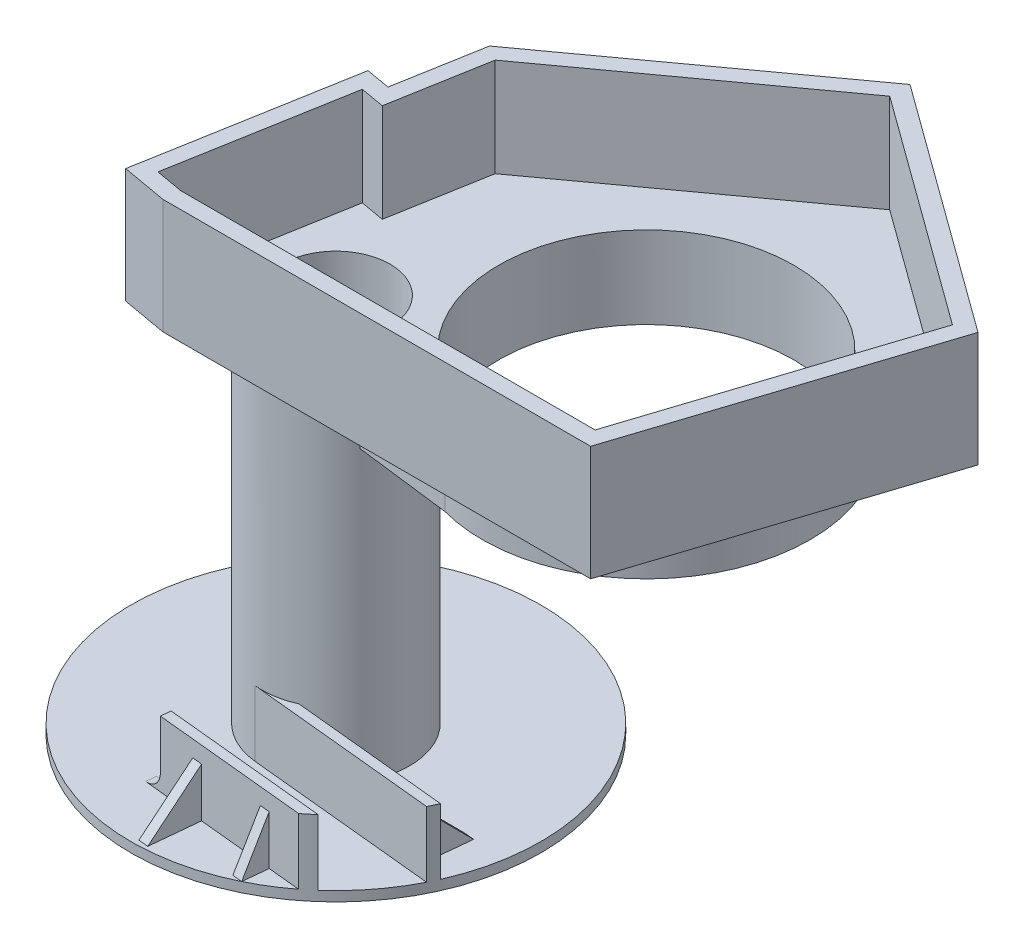
from build123d import *
from build123d.topology import SkipClean

# Parameters (mm, degrees)
SKETCH1_R               = 45
BOSS_EXTRUDE1_DEPTH     = 35
CUT_EXTRUDE1_DEPTH      = 30
BOSS_EXTRUDE2_START     = 20
SKETCH3_R               = 50
SKETCH3_R_2             = 45
BOSS_EXTRUDE2_DEPTH     = 20
SKETCH4_R               = 22.5
BOSS_EXTRUDE3_DEPTH     = 108
SKETCH5_R               = 62.5
BOSS_EXTRUDE4_DEPTH     = 3
CUT_EXTRUDE2_DEPTH      = 283.934340716
CUT_EXTRUDE2_DEPTH_BACK = 283.934340716
SKETCH6_R               = 16.5
CHAMFER1_START          = -20
CHAMFER1_DEPTH          = 20
BOSS_EXTRUDE5_START     = 20
BOSS_EXTRUDE5_DEPTH     = 20
CHAMFER3_START          = -59.701385296
CHAMFER3_DEPTH          = 31.623598411
CHAMFER3_START_2        = -32.908910756
CHAMFER3_2_DEPTH        = 24.320342802
CHAMFER3_START_3        = -75.100600507
CHAMFER3_3_DEPTH        = 17.710815412
CHAMFER3_START_4        = -108
CHAMFER3_4_DEPTH        = 20.0000001
CUT_EXTRUDE3_START      = 20
CUT_EXTRUDE3_DEPTH      = 20
CUT_EXTRUDE4_DEPTH      = 3
FILLET2_R               = 5


with BuildPart() as part:
    # Sketch1 → Boss-Extrude1 (new body)
    with BuildSketch(Plane(origin=(0, 0, 0), x_dir=(1, 0, 0), z_dir=(0, 1, 0))):
        Polygon((46.859255168, 63.80155033), (-83.545615043, 63.80155033), (-97.357476794, 66.23695421), (-86.281022646, 129.054647247), (-78.894964498, 127.752285914), (-74.254340533, 154.070572239), (0, 208.019508525), (75.819867549, 152.933150283), align=None)
        with Locations(Location((0, 127.60310066, 0), (0, 0, 90))):
            Circle(SKETCH1_R, mode=Mode.SUBTRACT)
    extrude(amount=BOSS_EXTRUDE1_DEPTH)

    # Sketch2 → Cut-Extrude1 (cut)
    with BuildSketch(Plane(origin=(0, 35, 0), x_dir=(1, 0, 0), z_dir=(0, 1, 0))):
        Polygon((69.942015026, 151.023320226), (0, 201.839168637), (-69.681093857, 151.212890552), (-74.839166621, 121.960006261), (-82.225224769, 123.262367593), (-91.56519714, 70.292752087), (-83.108171726, 68.80155033), (43.226542528, 68.80155033), align=None)
    extrude(amount=-CUT_EXTRUDE1_DEPTH, mode=Mode.SUBTRACT)

    # Sketch3 → Boss-Extrude2 (add)
    with BuildSketch(Plane.XZ.offset(BOSS_EXTRUDE2_START)):
        with Locations(Location((0, -127.60310066, 0), (0, 0, 270))):
            Circle(SKETCH3_R)
        with Locations(Location((0, -127.60310066, 0), (0, 0, 270))):
            Circle(SKETCH3_R_2, mode=Mode.SUBTRACT)
    extrude(amount=-BOSS_EXTRUDE2_DEPTH)

    # Sketch4 → Boss-Extrude3 (add)
    with BuildSketch(Plane.XZ):
        with Locations(Location((-61.853227661, -94.828442341, 0), (0, 0, 354.769849307))):
            Circle(SKETCH4_R)
    extrude(amount=BOSS_EXTRUDE3_DEPTH)

    # Sketch5 → Boss-Extrude4 (add)
    with BuildSketch(Plane.XZ.offset(108)):
        with Locations(Location((-61.853227661, -94.828442341, 0), (0, 0, 270))):
            Circle(SKETCH5_R)
    extrude(amount=BOSS_EXTRUDE4_DEPTH)

    # Sketch6 → Cut-Extrude2 (cut, two sides: drawn at the far end of the back side and taken through both)
    with BuildSketch(Plane.XZ.offset(111).offset(-CUT_EXTRUDE2_DEPTH_BACK)):
        with Locations(Location((-61.853227661, -94.828442341, 0), (0, 0, 270))):
            Circle(SKETCH6_R)
    extrude(amount=CUT_EXTRUDE2_DEPTH + CUT_EXTRUDE2_DEPTH_BACK, mode=Mode.SUBTRACT)

    # Chamfer1: read off the stored shape, not the designer's step
    # Chamfer1 outline → Chamfer1 (add)
    with BuildSketch(Plane(origin=(0, 0, 0), x_dir=(1, 0, 0), z_dir=(0, 1, 0)).offset(CHAMFER1_START)):
        with BuildLine():
            ThreePointArc((-47.573643712, 112.216469321), (-49.998001272, 128.050167568), (-47.290893773, 143.837981816))
            Line((-47.290893773, 143.837981816), (-60.85462884, 117.306271426))
            ThreePointArc((-60.85462884, 117.306271426), (-53.801380758, 115.838386688), (-47.573643712, 112.216469321))
        make_face()
        with BuildLine():
            Line((-42.693487755, 83.032071427), (-13.123343442, 79.356050419))
            ThreePointArc((-13.123343442, 79.356050419), (-27.706953652, 85.981895496), (-39.446904898, 96.879466533))
            ThreePointArc((-39.446904898, 96.879466533), (-39.947247216, 89.692488608), (-42.693487755, 83.032071427))
        make_face()
    extrude(amount=CHAMFER1_DEPTH)

    # Sketch7 → Boss-Extrude5 (add)
    with SkipClean():  # the faces are left unmerged after this step: merging them gives an invalid solid
        with BuildSketch(Plane(origin=(0, -108, 0), x_dir=(1, 0, 0), z_dir=(0, 1, 0)).offset(BOSS_EXTRUDE5_START)):
            with BuildLine():
                Line((-70.209230864, 52.9494319), (-20.454240978, 48.005649797))
                ThreePointArc((-20.454240978, 48.005649797), (-22.061100088, 46.632627344), (-23.713465467, 45.314721618))
                Line((-23.713465467, 45.314721618), (-70.50585779, 49.964132507))
                Line((-70.50585779, 49.964132507), (-70.209230864, 52.9494319))
            make_face()
            with BuildLine():
                Line((-64.077929608, 72.438696893), (-6.054139097, 66.673305768))
                ThreePointArc((-6.054139097, 66.673305768), (-5.354795719, 68.104348565), (-4.69214598, 69.552747672))
                Line((-4.69214598, 69.552747672), (-52.611335155, 74.314119956))
                ThreePointArc((-52.611335155, 74.314119956), (-58.221486515, 72.623477665), (-64.077929608, 72.438696893))
            make_face()
        extrude(amount=-BOSS_EXTRUDE5_DEPTH)

    # Chamfer3: read off the stored shape, not the designer's step
    # Chamfer3 outline → Chamfer3 (add)
    with SkipClean():  # the faces are left unmerged after this step: merging them gives an invalid solid
        with BuildSketch(Plane(origin=(0, 0, 0), x_dir=(0, 1, 0), z_dir=(0.9950997977115372, 0, 0.09887564206849853)).offset(CHAMFER3_START)):
            Polygon((-108, -68.747986192), (-108, -83.747986192), (-93, -68.747986192), align=None)
            Polygon((-108, -27.747986192), (-108, -42.747986192), (-93, -42.747986192), align=None)
        extrude(amount=CHAMFER3_DEPTH)

    # Chamfer3 2 outline → Chamfer3 2 (add)
    with SkipClean():  # the faces are left unmerged after this step: merging them gives an invalid solid
        with BuildSketch(Plane(origin=(0, 0, 0), x_dir=(0, 1, 0), z_dir=(0.9950997977115372, 0, 0.09887564206849853)).offset(CHAMFER3_START_2)):
            Polygon((-108, -68.747986192), (-108, -83.747986192), (-93, -68.747986192), align=None)
        extrude(amount=CHAMFER3_2_DEPTH)

    # Chamfer3 3 outline → Chamfer3 3 (add)
    with SkipClean():  # the faces are left unmerged after this step: merging them gives an invalid solid
        with BuildSketch(Plane(origin=(0, 0, 0), x_dir=(0, 1, 0), z_dir=(0.9950997977115372, 0, 0.09887564206849853)).offset(CHAMFER3_START_3)):
            Polygon((-108, -27.747986192), (-108, -42.747986192), (-93, -42.747986192), align=None)
        extrude(amount=CHAMFER3_3_DEPTH)

    # Chamfer3 4 outline → Chamfer3 4 (cut)
    with SkipClean():  # the faces are left unmerged after this step: merging them gives an invalid solid
        with BuildSketch(Plane(origin=(0, 0, 0), x_dir=(1, 0, 0), z_dir=(0, 1, 0)).offset(CHAMFER3_START_4)):
            with BuildLine():
                Line((-51.128200524, 89.240616922), (-51.879001502, 81.68443943))
                ThreePointArc((-51.879001502, 81.68443943), (-48.702503608, 84.863079484), (-46.501448484, 88.780891094))
                Line((-46.501448484, 88.780891094), (-51.128200524, 89.240616922))
            make_face()
            with BuildLine():
                ThreePointArc((-0.265846327, 84.186804289), (-2.029835327, 76.733920253), (-4.69214598, 69.552747672))
                Line((-4.69214598, 69.552747672), (-1.748980958, 69.260307324))
                Line((-1.748980958, 69.260307324), (-0.265846327, 84.186804289))
            make_face()
            with BuildLine():
                ThreePointArc((-23.713465467, 45.314721618), (-37.1988252, 37.396652892), (-52.227673534, 33.074100731))
                Line((-52.227673534, 33.074100731), (-25.196600099, 30.388224653))
                Line((-25.196600099, 30.388224653), (-23.713465467, 45.314721618))
            make_face()
        extrude(amount=CHAMFER3_4_DEPTH, mode=Mode.SUBTRACT)

    # Sketch9 → Cut-Extrude3 (cut)
    with SkipClean():  # the faces are left unmerged after this step: merging them gives an invalid solid
        with BuildSketch(Plane(origin=(0, -108, 0), x_dir=(1, 0, 0), z_dir=(0, 1, 0)).offset(CUT_EXTRUDE3_START)):
            Polygon((-61.020192816, 33.947747767), (-75.946689782, 35.430882398), (-74.463555151, 50.357379364), (-59.537058185, 48.874244733), align=None)
            Polygon((-56.551758792, 48.577617807), (-58.034893423, 33.651120841), (-38.132897469, 31.673608), (-36.649762838, 46.600104965), align=None)
            Polygon((-33.664463445, 46.303478039), (-35.147598076, 31.376981073), (-15.245602121, 29.399468232), (-13.76246749, 44.325965198), align=None)
            Polygon((-33.104139652, 87.449700478), (-34.587274283, 72.523203512), (-14.685278328, 70.54569067), (-13.202143697, 85.472187636), align=None)
            with BuildLine():
                Line((-36.089439045, 87.746327404), (-37.572573676, 72.819830438))
                Line((-37.572573676, 72.819830438), (-52.611335155, 74.314119956))
                ThreePointArc((-52.611335155, 74.314119956), (-44.996440318, 79.925465442), (-40.360787322, 88.170739412))
                Line((-40.360787322, 88.170739412), (-36.089439045, 87.746327404))
            make_face()
            with BuildLine():
                Line((-0.265846327, 84.186804289), (-10.216844304, 85.17556071))
                Line((-10.216844304, 85.17556071), (-11.699978935, 70.249063744))
                Line((-11.699978935, 70.249063744), (-4.69214598, 69.552747672))
                ThreePointArc((-4.69214598, 69.552747672), (-2.029835327, 76.733920253), (-0.265846327, 84.186804289))
            make_face()
        extrude(amount=-CUT_EXTRUDE3_DEPTH, mode=Mode.SUBTRACT)

    # Sketch10 → Cut-Extrude4 (cut)
    with SkipClean():  # the faces are left unmerged after this step: merging them gives an invalid solid
        with BuildSketch(Plane(origin=(-37.891198026, 0, -3.764965627), x_dir=(-0.09887564206850087, 0, 0.995099797711537), z_dir=(-0.995099797711537, 0, -0.09887564206850087))):
            Polygon((-42.747986192, -93), (-35.076363954, -108), (-30.076363954, -108), (-30.076363954, -93), align=None)
        extrude(amount=CUT_EXTRUDE4_DEPTH, mode=Mode.SUBTRACT)

    # Fillet2
    # the kernel refuses this fillet: 5 mm, written as the material it adds along each edge
    with BuildSketch(Plane(origin=(-70.50585779, -108, -49.964132507), x_dir=(-0.9950997977115372, 0, -0.09887564206849696), z_dir=(0.09887564206849697, 0, -0.9950997977115373))) as fillet2_piece_1:
        with BuildLine():
            CenterArc((FILLET2_R, FILLET2_R), FILLET2_R, 180, 90)
            Line((0, FILLET2_R), (0, 0))
            Line((0, 0), (FILLET2_R, 0))
        make_face()
    extrude(amount=3)


solid = part.part
